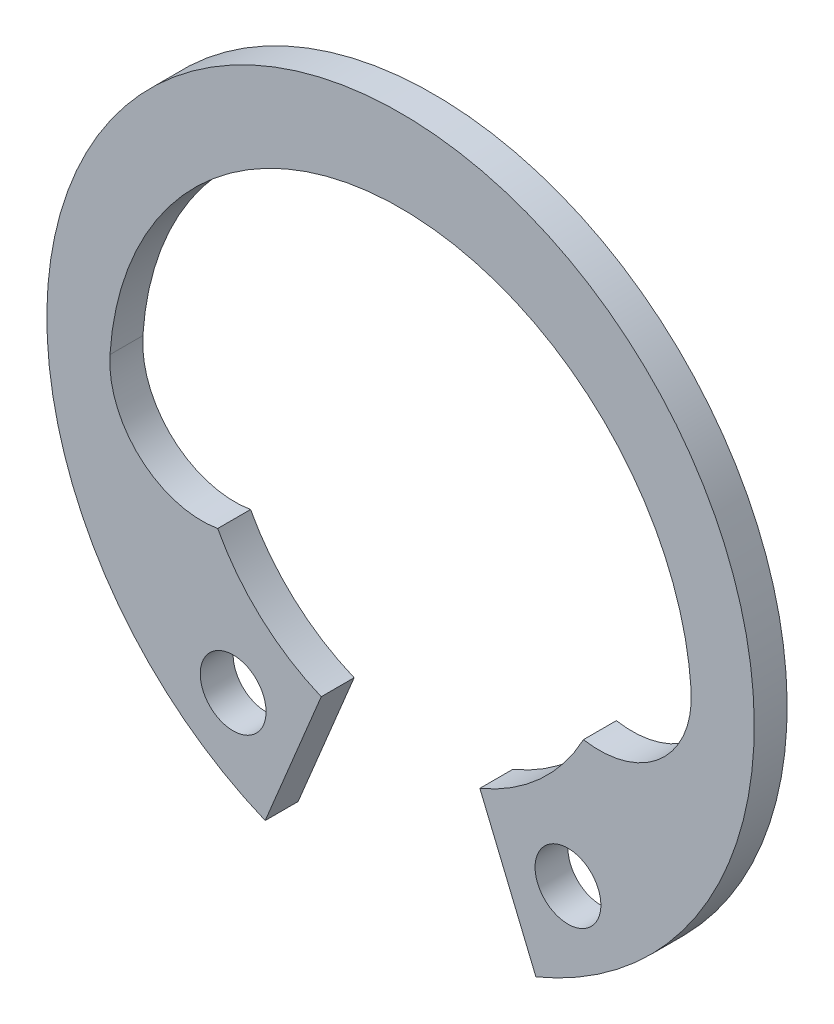
from build123d import *

# Parameters (mm, degrees)
SKETCH1_R  = 1
BODY_DEPTH = 1


with BuildPart() as part:
    # Sketch1 → Body (new body)
    with BuildSketch(Plane.XY):
        with BuildLine():
            Line((-2.410905624, -5.820441055), (-4.113846898, -9.931704974))
            ThreePointArc((-4.113846898, -9.931704974), (0, 10.75), (4.113846898, -9.931704974))
            Line((4.113846898, -9.931704974), (2.410905624, -5.820441055))
            ThreePointArc((2.410905624, -5.820441055), (4.232413877, -4.666548272), (5.558129248, -2.966007293))
            ThreePointArc((5.558129248, -2.966007293), (7.908430264, -2.290246226), (8.83133721, -0.025558466))
            ThreePointArc((8.83133721, -0.025558466), (0, 8.25), (-8.83133721, -0.025558466))
            ThreePointArc((-8.83133721, -0.025558466), (-7.908430264, -2.290246226), (-5.558129248, -2.966007293))
            ThreePointArc((-5.558129248, -2.966007293), (-4.232413877, -4.666548272), (-2.410905624, -5.820441055))
        make_face()
        with Locations((5.087937676, -7.057116281)):
            Circle(SKETCH1_R, mode=Mode.SUBTRACT)
        with Locations((-5.087937676, -7.057116281)):
            Circle(SKETCH1_R, mode=Mode.SUBTRACT)
    extrude(amount=-BODY_DEPTH)


solid = part.part
